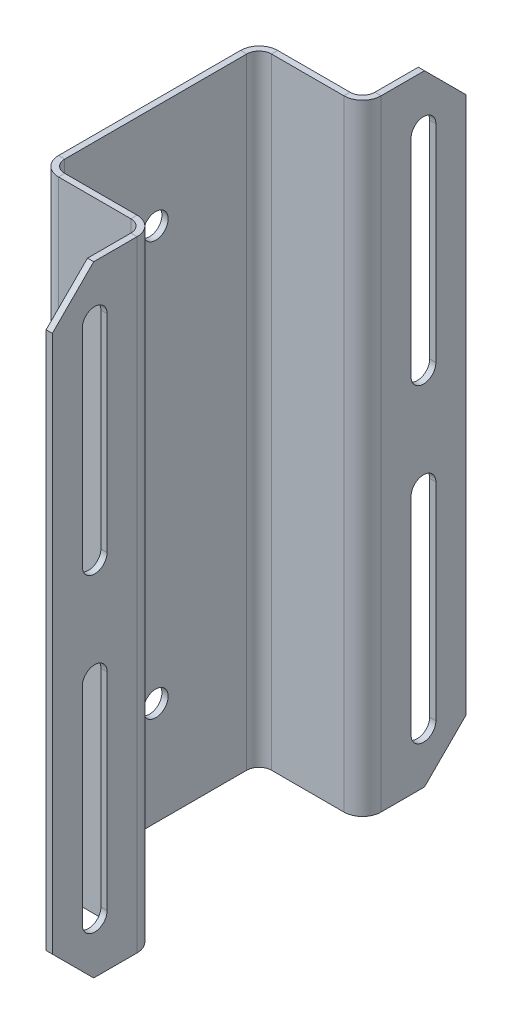
from build123d import *

# Parameters (mm, degrees)
BASE_FLANGE1_DEPTH = 150
CHAMFER1_SIZE      = 10
SKETCH6_R          = 3
CUT_EXTRUDE1_DEPTH = 10
CUT_EXTRUDE2_DEPTH = 10


# Sheet-metal steps are written as plain solids
with BuildPart() as part:
    # Sketch1 → Base-Flange1 (new body)
    with BuildSketch(Plane(origin=(0, 0, 0), x_dir=(1, 0, 0), z_dir=(0, 1, 0))):
        with BuildLine():
            Line((25, -25), (25, -4.5))
            ThreePointArc((25, -4.5), (23.681980515, -1.318019485), (20.5, 0))
            Line((20.5, 0), (3, 0))
            ThreePointArc((3, 0), (0.878679656, 0.878679656), (0, 3))
            Line((0, 3), (0, 47))
            ThreePointArc((0, 47), (0.878679656, 49.121320344), (3, 50))
            Line((3, 50), (20.5, 50))
            ThreePointArc((20.5, 50), (23.681980515, 51.318019485), (25, 54.5))
            Line((25, 54.5), (25, 75))
            Line((25, 75), (23.5, 75))
            Line((23.5, 75), (23.5, 54.5))
            ThreePointArc((23.5, 54.5), (22.621320344, 52.378679656), (20.5, 51.5))
            Line((20.5, 51.5), (3, 51.5))
            ThreePointArc((3, 51.5), (-0.181980515, 50.181980515), (-1.5, 47))
            Line((-1.5, 47), (-1.5, 3))
            ThreePointArc((-1.5, 3), (-0.181980515, -0.181980515), (3, -1.5))
            Line((3, -1.5), (20.5, -1.5))
            ThreePointArc((20.5, -1.5), (22.621320344, -2.378679656), (23.5, -4.5))
            Line((23.5, -4.5), (23.5, -25))
            Line((23.5, -25), (25, -25))
        make_face()
    extrude(amount=BASE_FLANGE1_DEPTH)

    # Chamfer1
    chamfer1_edges = [part.edges().sort_by_distance(p)[0] for p in [
        (24.25, 0, -75),
        (24.25, 0, 25),
        (24.25, 150, -75),
        (24.25, 150, 25),
    ]]
    chamfer(chamfer1_edges, length=CHAMFER1_SIZE)

    # Sketch6 → Cut-Extrude1 (cut)
    with BuildSketch(Plane.ZY.offset(1.5)):
        with Locations((-25, 25)):
            Circle(SKETCH6_R)
        with Locations((-25, 125)):
            Circle(SKETCH6_R)
    extrude(amount=-CUT_EXTRUDE1_DEPTH, mode=Mode.SUBTRACT)

    # Sketch7 → Cut-Extrude2 (cut)
    with BuildSketch(Plane.ZY.offset(-23.5)):
        with BuildLine():
            Line((-67.75, 12.5), (-67.75, 62.5))
            ThreePointArc((-67.75, 62.5), (-64.75, 65.5), (-61.75, 62.5))
            Line((-61.75, 62.5), (-61.75, 12.5))
            ThreePointArc((-61.75, 12.5), (-64.75, 9.5), (-67.75, 12.5))
        make_face()
        with BuildLine():
            Line((-67.75, 137.5), (-67.75, 87.5))
            ThreePointArc((-67.75, 87.5), (-64.75, 84.5), (-61.75, 87.5))
            Line((-61.75, 87.5), (-61.75, 137.5))
            ThreePointArc((-61.75, 137.5), (-64.75, 140.5), (-67.75, 137.5))
        make_face()
        with BuildLine():
            Line((17.75, 137.5), (17.75, 87.5))
            ThreePointArc((17.75, 87.5), (14.75, 84.5), (11.75, 87.5))
            Line((11.75, 87.5), (11.75, 137.5))
            ThreePointArc((11.75, 137.5), (14.75, 140.5), (17.75, 137.5))
        make_face()
        with BuildLine():
            Line((17.75, 12.5), (17.75, 62.5))
            ThreePointArc((17.75, 62.5), (14.75, 65.5), (11.75, 62.5))
            Line((11.75, 62.5), (11.75, 12.5))
            ThreePointArc((11.75, 12.5), (14.75, 9.5), (17.75, 12.5))
        make_face()
    extrude(amount=-CUT_EXTRUDE2_DEPTH, mode=Mode.SUBTRACT)


solid = part.part
